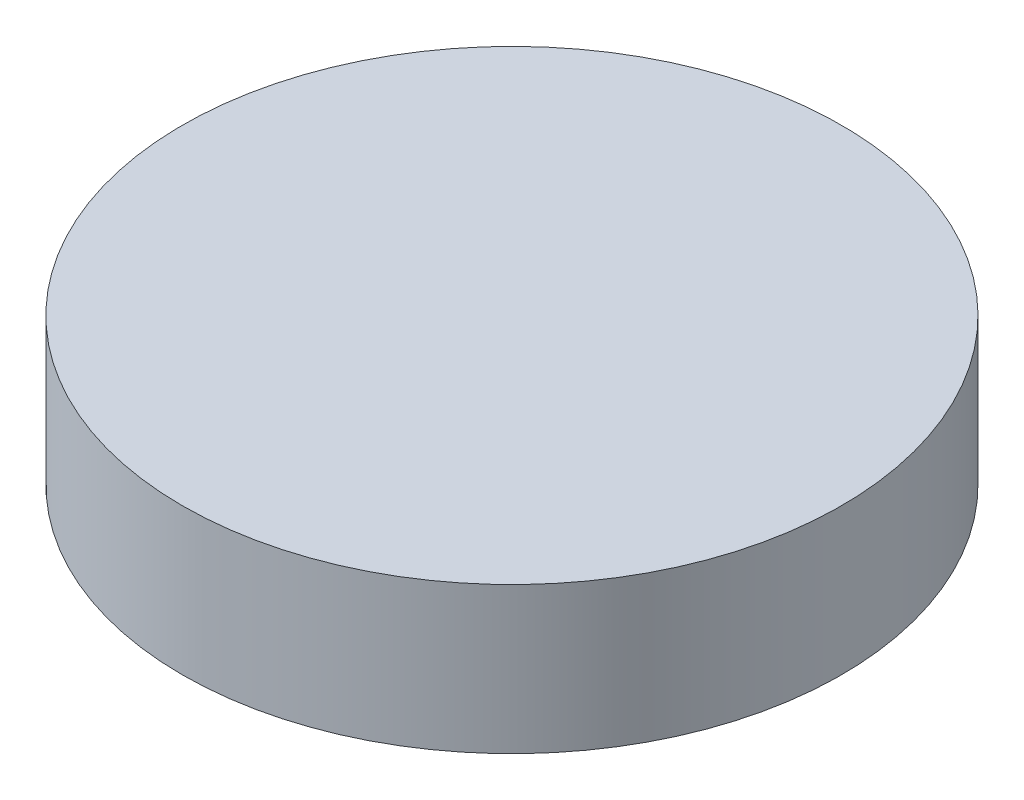
from build123d import *

# Parameters (mm, degrees)
BOSS_EXTRUDE1_DEPTH      = 5
BOSS_EXTRUDE1_DEPTH_BACK = 5
SKETCH1_R                = 22.5


with BuildPart() as part:
    # Sketch1 → Boss-Extrude1 (new, two sides: drawn at the far end of the back side and taken through both)
    with BuildSketch(Plane(origin=(0, 0, 0), x_dir=(1, 0, 0), z_dir=(0, 1, 0)).offset(-BOSS_EXTRUDE1_DEPTH_BACK)):
        Circle(SKETCH1_R)
    extrude(amount=BOSS_EXTRUDE1_DEPTH + BOSS_EXTRUDE1_DEPTH_BACK)


solid = part.part
